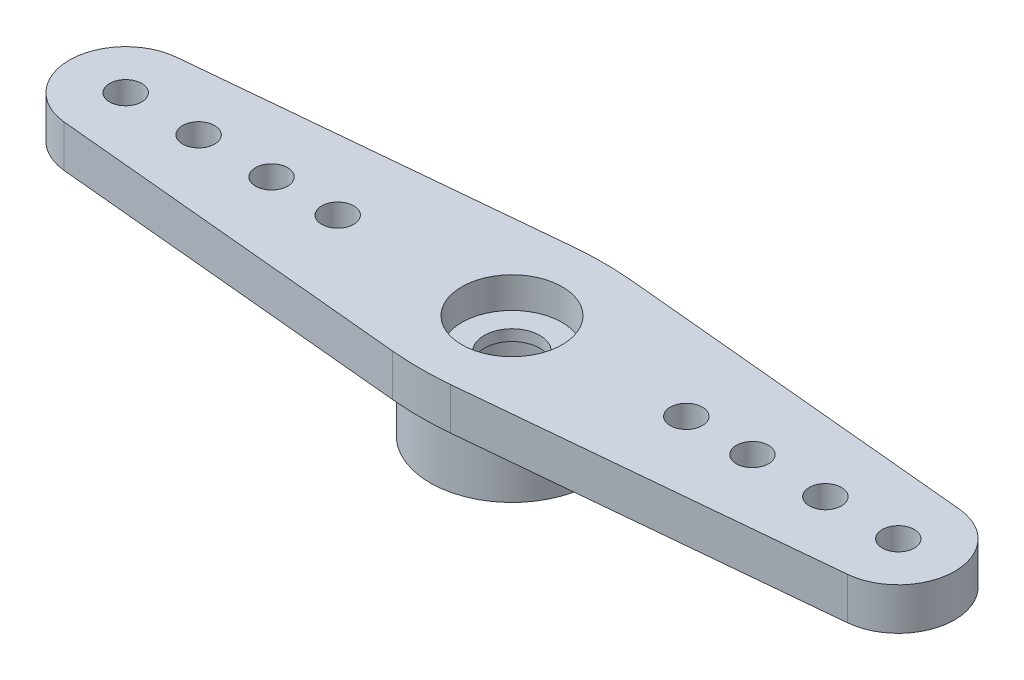
from build123d import *

# Parameters (mm, degrees)
SKETCH1_R           = 3.3655
SKETCH1_R_2         = 2.2352
BOSS_EXTRUDE1_DEPTH = 2.54
SKETCH2_R           = 0.6604
SKETCH2_R_2         = 1.143
BOSS_EXTRUDE2_DEPTH = 1.7272
FILLET1_R           = 12.7
CUT_EXTRUDE1_START  = -1.27
SKETCH3_R           = 2.06375
SKETCH3_R_2         = 1.143
CUT_EXTRUDE1_DEPTH  = 1.27


with BuildPart() as part:
    # Sketch1 → Boss-Extrude1 (new body)
    with BuildSketch(Plane(origin=(0, 0, 0), x_dir=(1, 0, 0), z_dir=(0, 1, 0))):
        Circle(SKETCH1_R)
        Circle(SKETCH1_R_2, mode=Mode.SUBTRACT)
    extrude(amount=BOSS_EXTRUDE1_DEPTH)

    # Sketch2 → Boss-Extrude2 (add)
    with BuildSketch(Plane(origin=(0, 2.54, 0), x_dir=(1, 0, 0), z_dir=(0, 1, 0))):
        with BuildLine():
            Line((0, 3.8227), (-16.092265178, 2.307544345))
            ThreePointArc((-16.092265178, 2.307544345), (-18.19275, 0), (-16.092265178, -2.307544345))
            Line((-16.092265178, -2.307544345), (0, -3.8227))
            Line((0, -3.8227), (16.092265178, -2.307544345))
            ThreePointArc((16.092265178, -2.307544345), (18.19275, 0), (16.092265178, 2.307544345))
            Line((16.092265178, 2.307544345), (0, 3.8227))
        make_face()
        with Locations((9.8806, 0)):
            Circle(SKETCH2_R, mode=Mode.SUBTRACT)
        with Locations((12.8778, 0)):
            Circle(SKETCH2_R, mode=Mode.SUBTRACT)
        with Locations((7.1628, 0)):
            Circle(SKETCH2_R, mode=Mode.SUBTRACT)
        with Locations((-7.1628, 0)):
            Circle(SKETCH2_R, mode=Mode.SUBTRACT)
        with Locations((-12.8778, 0)):
            Circle(SKETCH2_R, mode=Mode.SUBTRACT)
        with Locations((-9.8806, 0)):
            Circle(SKETCH2_R, mode=Mode.SUBTRACT)
        with Locations((15.875, 0)):
            Circle(SKETCH2_R, mode=Mode.SUBTRACT)
        with Locations((-15.875, 0)):
            Circle(SKETCH2_R, mode=Mode.SUBTRACT)
        Circle(SKETCH2_R_2, mode=Mode.SUBTRACT)
    extrude(amount=BOSS_EXTRUDE2_DEPTH)

    # Fillet1
    fillet1_edges = [part.edges().sort_by_distance(p)[0] for p in [
        (0, 3.4036, -3.8227),
        (0, 3.4036, 3.8227),
    ]]
    fillet(fillet1_edges, radius=FILLET1_R)

    # Sketch3 → Cut-Extrude1 (cut)
    with BuildSketch(Plane(origin=(0, 4.2672, 0), x_dir=(1, 0, 0), z_dir=(0, 1, 0)).offset(CUT_EXTRUDE1_START)):
        Circle(SKETCH3_R)
        Circle(SKETCH3_R_2, mode=Mode.SUBTRACT)
    extrude(amount=CUT_EXTRUDE1_DEPTH, mode=Mode.SUBTRACT)


solid = part.part
